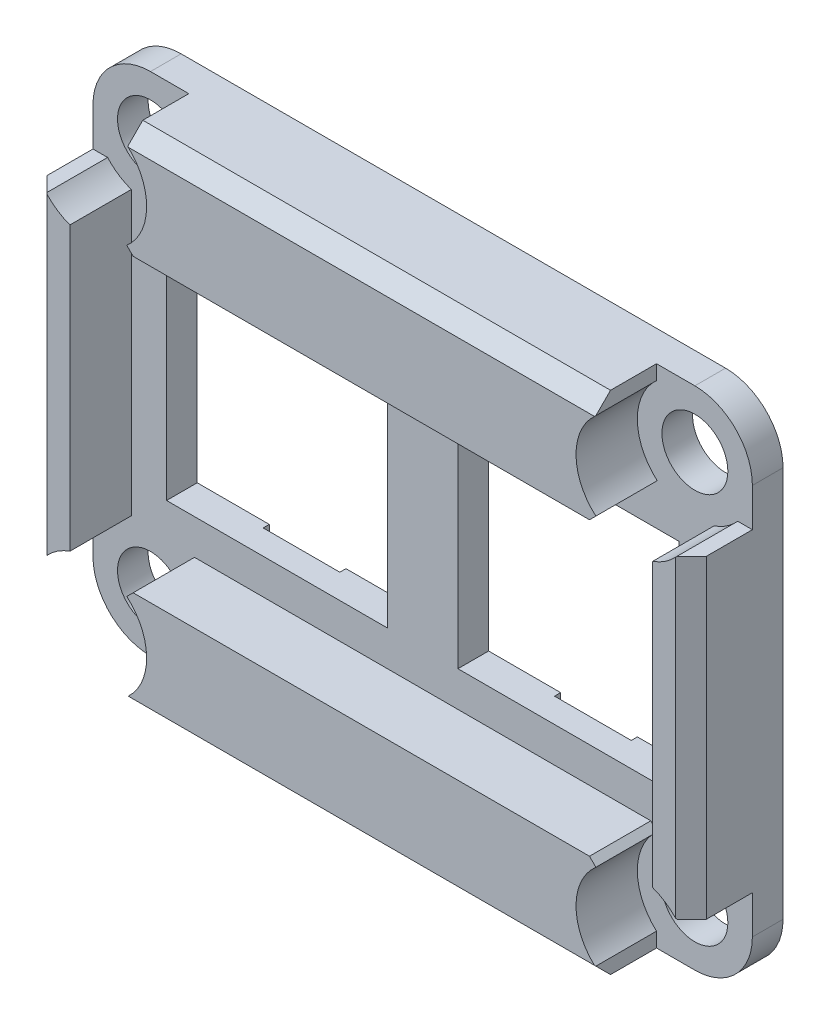
from build123d import *

# Parameters (mm, degrees)
SKETCH_1_R          = 2.15
SKETCH_1_W          = 14.4
SKETCH_1_H          = 14.4
EXTRUDE_1_DEPTH     = 6
CUT_EXTRUDE_START   = -4
CUT_EXTRUDE_1_DEPTH = 4
CHAMFER_1_SIZE      = 1
SKETCH_4_W          = 5
SKETCH_4_H          = 1
CUT_EXTRUDE_2_DEPTH = 0.4


with BuildPart() as part:
    # Эскиз1 → Бобышка-Вытянуть1 (new body)
    with BuildSketch(Plane.XY):
        with BuildLine():
            Line((17.75, 16.5), (-17.75, 16.5))
            ThreePointArc((-17.75, 16.5), (-20.401650429, 15.401650429), (-21.5, 12.75))
            Line((-21.5, 12.75), (-21.5, -12.75))
            ThreePointArc((-21.5, -12.75), (-20.401650429, -15.401650429), (-17.75, -16.5))
            Line((-17.75, -16.5), (17.75, -16.5))
            ThreePointArc((17.75, -16.5), (20.401650429, -15.401650429), (21.5, -12.75))
            Line((21.5, -12.75), (21.5, 12.75))
            ThreePointArc((21.5, 12.75), (20.401650429, 15.401650429), (17.75, 16.5))
        make_face()
        with Locations((-17.75, 12.75)):
            Circle(SKETCH_1_R, mode=Mode.SUBTRACT)
        with Locations((17.75, 12.75)):
            Circle(SKETCH_1_R, mode=Mode.SUBTRACT)
        with Locations((-17.75, -12.75)):
            Circle(SKETCH_1_R, mode=Mode.SUBTRACT)
        with Locations((17.75, -12.75)):
            Circle(SKETCH_1_R, mode=Mode.SUBTRACT)
        with Locations((-9.5, 0)):
            Rectangle(SKETCH_1_W, SKETCH_1_H, mode=Mode.SUBTRACT)
        with Locations((9.5, 0)):
            Rectangle(SKETCH_1_W, SKETCH_1_H, mode=Mode.SUBTRACT)
    extrude(amount=EXTRUDE_1_DEPTH)

    # Эскиз2 → Вырез-Вытянуть1 (cut)
    with BuildSketch(Plane.XY.offset(6).offset(CUT_EXTRUDE_START)):
        with BuildLine():
            Line((-21.5, 10.25), (-20.545084972, 10.25))
            ThreePointArc((-20.545084972, 10.25), (-19.837764528, 9.634917453), (-19, 9.214466094))
            Line((-19, 9.214466094), (-19, -9.214466094))
            ThreePointArc((-19, -9.214466094), (-19.837764528, -9.634917453), (-20.545084972, -10.25))
            Line((-20.545084972, -10.25), (-21.5, -10.25))
            Line((-21.5, -10.25), (-21.5, -12.75))
            ThreePointArc((-21.5, -12.75), (-20.401650429, -15.401650429), (-17.75, -16.5))
            Line((-17.75, -16.5), (-15.25, -16.5))
            Line((-15.25, -16.5), (-15.25, -15.545084972))
            ThreePointArc((-15.25, -15.545084972), (-14.020147597, -12.361797664), (-15.879171307, -9.5))
            Line((-15.879171307, -9.5), (15.879171307, -9.5))
            ThreePointArc((15.879171307, -9.5), (14.020147597, -12.361797664), (15.25, -15.545084972))
            Line((15.25, -15.545084972), (15.25, -16.5))
            Line((15.25, -16.5), (17.75, -16.5))
            ThreePointArc((17.75, -16.5), (20.401650429, -15.401650429), (21.5, -12.75))
            Line((21.5, -12.75), (21.5, -10.25))
            Line((21.5, -10.25), (20.545084972, -10.25))
            ThreePointArc((20.545084972, -10.25), (19.837764528, -9.634917453), (19, -9.214466094))
            Line((19, -9.214466094), (19, 9.214466094))
            ThreePointArc((19, 9.214466094), (19.837764528, 9.634917453), (20.545084972, 10.25))
            Line((20.545084972, 10.25), (21.5, 10.25))
            Line((21.5, 10.25), (21.5, 12.75))
            ThreePointArc((21.5, 12.75), (20.401650429, 15.401650429), (17.75, 16.5))
            Line((17.75, 16.5), (15.25, 16.5))
            Line((15.25, 16.5), (15.25, 15.545084972))
            ThreePointArc((15.25, 15.545084972), (14.020147597, 12.361797664), (15.879171307, 9.5))
            Line((15.879171307, 9.5), (-15.879171307, 9.5))
            ThreePointArc((-15.879171307, 9.5), (-14.020147597, 12.361797664), (-15.25, 15.545084972))
            Line((-15.25, 15.545084972), (-15.25, 16.5))
            Line((-15.25, 16.5), (-17.75, 16.5))
            ThreePointArc((-17.75, 16.5), (-20.401650429, 15.401650429), (-21.5, 12.75))
            Line((-21.5, 12.75), (-21.5, 10.25))
        make_face()
    extrude(amount=CUT_EXTRUDE_1_DEPTH, mode=Mode.SUBTRACT)

    # Фаска1
    # the kernel refuses this chamfer: 1, 0.732303349 mm, written as the material it takes off along each edge
    with BuildSketch(Plane(origin=(15.879171307, 9.5, 2), x_dir=(-0.8149940779202551, 0.5794692856009827, 0), z_dir=(0, 0, 1))) as chamfer_1_piece_1:
        with BuildLine():
            Line((0.717121745, 0), (CHAMFER_1_SIZE * 0.81499407792, CHAMFER_1_SIZE * 0.579469285601))
            Line((CHAMFER_1_SIZE * 0.81499407792, CHAMFER_1_SIZE * 0.579469285601), (0, 0))
            ThreePointArc((0, 0), (0.355196947, 0.017179972), (0.717121745, 0))
        make_face()
    extrude(amount=6.571682988, mode=Mode.SUBTRACT)
    with BuildSketch(Plane(origin=(-15.879171307, 9.5, 2), x_dir=(1, 0, 0), z_dir=(0, 0, 1))) as chamfer_1_piece_2:
        with BuildLine():
            Line((CHAMFER_1_SIZE, 0), (0.584449975, 0.415550025))
            ThreePointArc((0.584449975, 0.415550025), (0.299438674, 0.191824146), (0, 0))
            Line((0, 0), (CHAMFER_1_SIZE, 0))
        make_face()
    extrude(amount=6.571682988, mode=Mode.SUBTRACT)
    with BuildSketch(Plane(origin=(15.879171307, -9.5, 2), x_dir=(-0.8149940779202558, -0.5794692856009814, 0), z_dir=(0, 0, 1))) as chamfer_1_piece_3:
        with BuildLine():
            Line((0.717121745, 0), (CHAMFER_1_SIZE * 0.81499407792, -CHAMFER_1_SIZE * 0.579469285601))
            Line((CHAMFER_1_SIZE * 0.81499407792, -CHAMFER_1_SIZE * 0.579469285601), (0, 0))
            ThreePointArc((0, 0), (0.355196947, -0.017179972), (0.717121745, 0))
        make_face()
    extrude(amount=6.571682988, mode=Mode.SUBTRACT)
    with BuildSketch(Plane(origin=(-15.879171307, -9.5, 2), x_dir=(1, 0, 0), z_dir=(0, 0, 1))) as chamfer_1_piece_4:
        with BuildLine():
            Line((CHAMFER_1_SIZE, 0), (0.584449975, -0.415550025))
            ThreePointArc((0.584449975, -0.415550025), (0.299438674, -0.191824146), (0, 0))
            Line((0, 0), (CHAMFER_1_SIZE, 0))
        make_face()
    extrude(amount=6.571682988, mode=Mode.SUBTRACT)
    with BuildSketch(Plane(origin=(21.5, -12.821682988, 6), x_dir=(0, 0, -1), z_dir=(0, 1, 0)), Plane(origin=(-21.5, 12.821682988, 6), x_dir=(0, 0, -1), z_dir=(0, -1, 0))) as chamfer_1_piece_5:
        Polygon((CHAMFER_1_SIZE, 0), (0, CHAMFER_1_SIZE), (0, 0), align=None)
    extrude(amount=25.643365976, mode=Mode.SUBTRACT)
    with BuildSketch(Plane(origin=(-17.821682988, -16.5, 6), x_dir=(0, 0, -1), z_dir=(1, 0, 0)), Plane(origin=(17.821682988, 16.5, 6), x_dir=(0, 0, -1), z_dir=(-1, 0, 0))) as chamfer_1_piece_6:
        Polygon((CHAMFER_1_SIZE, 0), (0, CHAMFER_1_SIZE), (0, 0), align=None)
    extrude(amount=35.643365976, mode=Mode.SUBTRACT)

    # Эскиз4 → Вырез-Вытянуть2 (cut)
    with BuildSketch(Plane(origin=(0, 0, 0), x_dir=(-1, 0, 0), z_dir=(0, 0, -1))):
        with Locations((9.5, -7.7)):
            Rectangle(SKETCH_4_W, SKETCH_4_H)
        with Locations((9.5, 7.7)):
            Rectangle(SKETCH_4_W, SKETCH_4_H)
        with Locations((-9.5, 7.7)):
            Rectangle(SKETCH_4_W, SKETCH_4_H)
        with Locations((-9.5, -7.7)):
            Rectangle(SKETCH_4_W, SKETCH_4_H)
    extrude(amount=-CUT_EXTRUDE_2_DEPTH, mode=Mode.SUBTRACT)


solid = part.part
